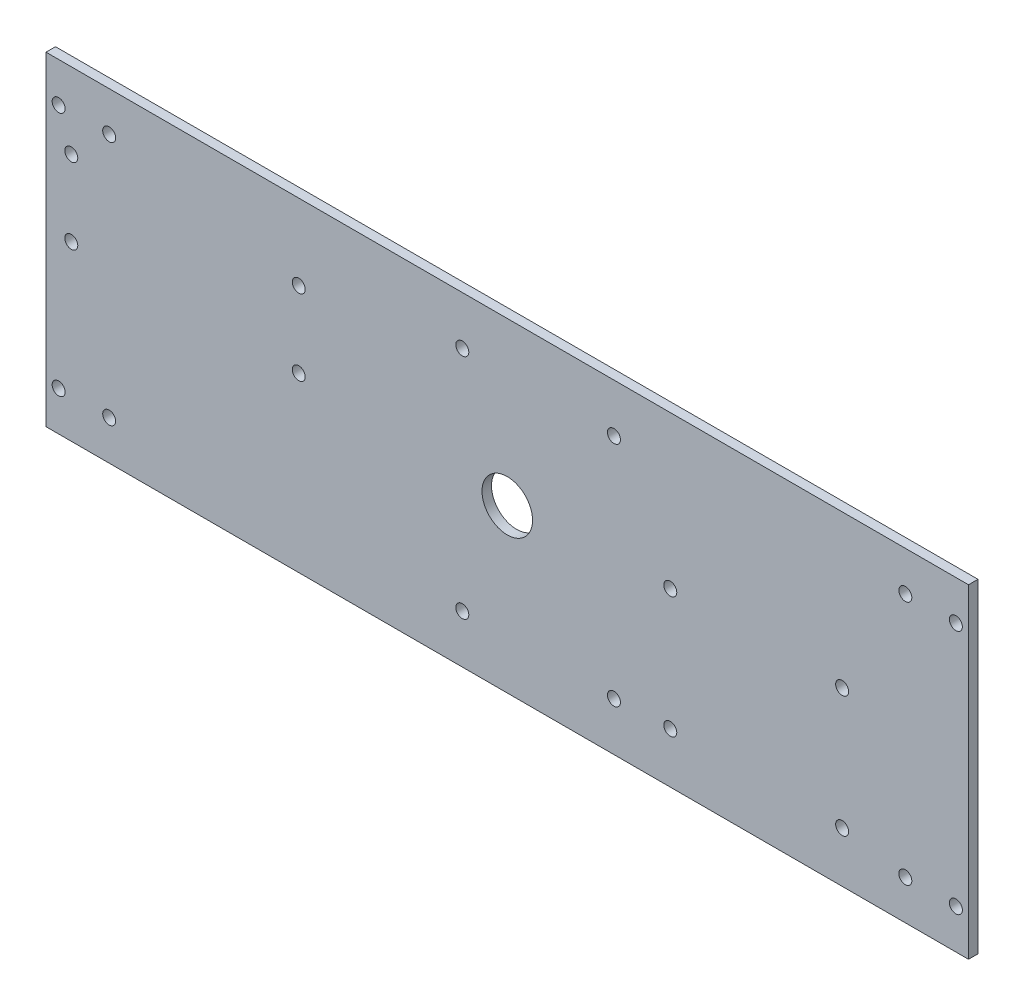
from build123d import *

# Parameters (mm, degrees)
SKETCH1_W                      = 231.775
SKETCH1_H                      = 81.4959
BOSS_EXTRUDE1_DEPTH            = 2.38125
F_4_CLEARANCE_HOLE1_D          = 3.2639
F_4_CLEARANCE_HOLE2_AT_2_COUNT = 2
F_4_CLEARANCE_HOLE2_AT_2_PITCH = 12.7
F_1_2_0_5_DIAMETER_HOLE1_D     = 12.7
F_4_CLEARANCE_HOLE3_D          = 3.2639


with BuildPart() as part:
    # Sketch1 → Boss-Extrude1 (new body)
    with BuildSketch(Plane.XY):
        Rectangle(SKETCH1_W, SKETCH1_H)
    extrude(amount=BOSS_EXTRUDE1_DEPTH)

    # #4 Clearance Hole1 (through all)
    with Locations(Plane.XY.offset(2.38125)):
        with Locations((-11.29792, 28.575), (26.80208, 28.575)):
            f_4_clearance_hole1 = Hole(F_4_CLEARANCE_HOLE1_D / 2)

    # Mirror1: #4 Clearance Hole1 across plane
    add(f_4_clearance_hole1.mirror(Plane.ZX), mode=Mode.SUBTRACT)

    # Sketch6 → #4 Clearance Hole2 (revolve, cut)
    with BuildSketch(Plane(origin=(-112.7125, 30.82036, 2.38125), x_dir=(0, -1, 0), z_dir=(1, 0, 0))):
        Polygon((0, 0), (0, 10.505574487), (1.63195, 9.525), (1.63195, 0), align=None)
    f_4_clearance_hole2 = revolve(axis=Axis((-112.7125, 30.82036, 8.73125), (0, 0, -1)), mode=Mode.SUBTRACT)

    # #4 Clearance Hole2 at 2: #4 Clearance Hole2 ×2
    with Locations(*[(i * F_4_CLEARANCE_HOLE2_AT_2_PITCH, 0, 0) for i in range(1, F_4_CLEARANCE_HOLE2_AT_2_COUNT)]):
        add(f_4_clearance_hole2, mode=Mode.SUBTRACT)

    # Mirror2: #4 Clearance Hole2 across plane
    add(f_4_clearance_hole2.mirror(Plane(origin=(0, 0, 0), x_dir=(0, 0, 1), z_dir=(1, 0, 0))), mode=Mode.SUBTRACT)

    # Mirror2 copy 1 sketch → Mirror2 copy 1 (revolve, cut)
    with BuildSketch(Plane(origin=(100.0125, 30.82036, 2.38125), x_dir=(0, -1, 0), z_dir=(-1, 0, 0))):
        Polygon((0, 0), (0, -10.505574487), (1.63195, -9.525), (1.63195, 0), align=None)
    revolve(axis=Axis((100.0125, 30.82036, 8.73125), (0, 0, 1)), mode=Mode.SUBTRACT)

    # Mirror3 copy 1 sketch → Mirror3 copy 1 (revolve, cut)
    with BuildSketch(Plane(origin=(112.7125, -30.82036, 2.38125), x_dir=(0, 1, 0), z_dir=(-1, 0, 0))):
        Polygon((0, 0), (0, 10.505574487), (1.63195, 9.525), (1.63195, 0), align=None)
    revolve(axis=Axis((112.7125, -30.82036, 8.73125), (0, 0, -1)), mode=Mode.SUBTRACT)

    # Mirror3 copy 2 sketch → Mirror3 copy 2 (revolve, cut)
    with BuildSketch(Plane(origin=(100.0125, -30.82036, 2.38125), x_dir=(0, 1, 0), z_dir=(-1, 0, 0))):
        Polygon((0, 0), (0, 10.505574487), (1.63195, 9.525), (1.63195, 0), align=None)
    revolve(axis=Axis((100.0125, -30.82036, 8.73125), (0, 0, -1)), mode=Mode.SUBTRACT)

    # Mirror3 copy 3 sketch → Mirror3 copy 3 (revolve, cut)
    with BuildSketch(Plane(origin=(-112.7125, -30.82036, 2.38125), x_dir=(0, 1, 0), z_dir=(1, 0, 0))):
        Polygon((0, 0), (0, -10.505574487), (1.63195, -9.525), (1.63195, 0), align=None)
    revolve(axis=Axis((-112.7125, -30.82036, 8.73125), (0, 0, 1)), mode=Mode.SUBTRACT)

    # Mirror3 copy 4 sketch → Mirror3 copy 4 (revolve, cut)
    with BuildSketch(Plane(origin=(-100.0125, -30.82036, 2.38125), x_dir=(0, 1, 0), z_dir=(1, 0, 0))):
        Polygon((0, 0), (0, -10.505574487), (1.63195, -9.525), (1.63195, 0), align=None)
    revolve(axis=Axis((-100.0125, -30.82036, 8.73125), (0, 0, 1)), mode=Mode.SUBTRACT)

    # 1/2 (0.5) Diameter Hole1 (through all)
    with Locations(Plane.XY.offset(2.38125)):
        with Locations((0, 0)):
            Hole(F_1_2_0_5_DIAMETER_HOLE1_D / 2)

    # #4 Clearance Hole3 (through all)
    with Locations(Plane.XY.offset(2.38125)):
        with Locations((-109.5375, 21.69795), (-109.5375, 2.64795), (-52.3875, 2.64795), (-52.3875, 21.69795), (40.9575, 2.43205), (84.1375, 2.43205), (84.1375, -28.04795), (40.9575, -28.04795)):
            Hole(F_4_CLEARANCE_HOLE3_D / 2)


solid = part.part
